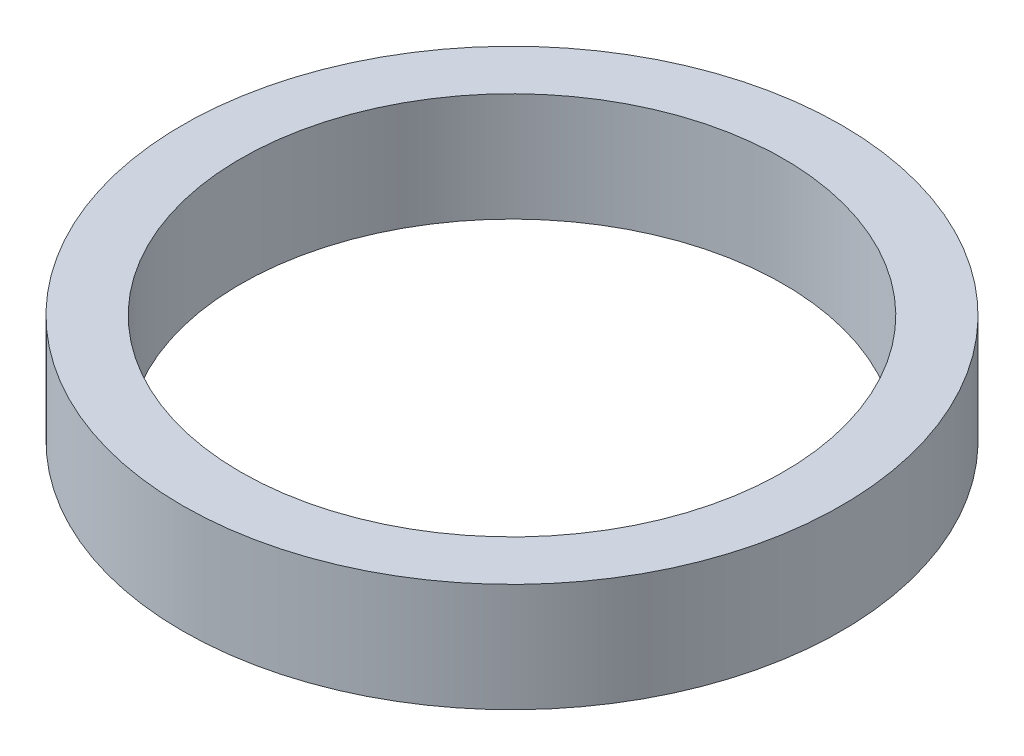
from build123d import *

# Parameters (mm, degrees)
SKETCH1_R           = 42.5
BOSS_EXTRUDE1_DEPTH = 14
SKETCH2_R           = 35
CUT_EXTRUDE1_DEPTH  = 62.713045622


with BuildPart() as part:
    # Sketch1 → Boss-Extrude1 (new body)
    with BuildSketch(Plane(origin=(0, 0, 0), x_dir=(1, 0, 0), z_dir=(0, 1, 0))):
        Circle(SKETCH1_R)
    extrude(amount=BOSS_EXTRUDE1_DEPTH)

    # Sketch2 → Cut-Extrude1 (cut, through all)
    with BuildSketch(Plane(origin=(0, 0, 0), x_dir=(1, 0, 0), z_dir=(0, 1, 0))):
        Circle(SKETCH2_R)
    extrude(amount=CUT_EXTRUDE1_DEPTH, mode=Mode.SUBTRACT)


solid = part.part
